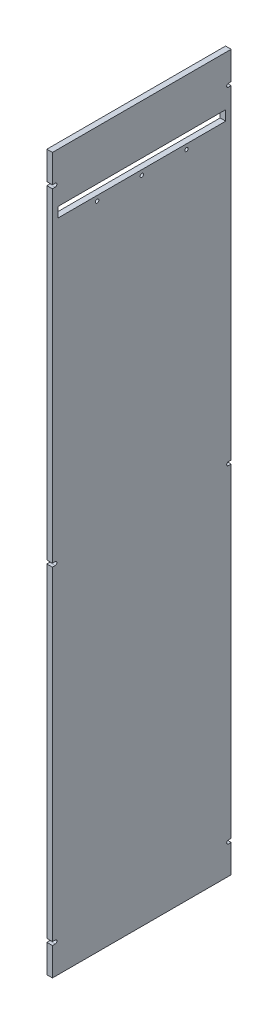
from build123d import *

# Parameters (mm, degrees)
SKETCH1_W             = 4.7625
SKETCH1_H             = 152.4
BOSS_EXTRUDE1_DEPTH   = 609.6
SKETCH2_W             = 143.129
SKETCH2_H             = 8.509
CUT_EXTRUDE1_DEPTH    = 629.379345146
F_4_CLEARANCE_HOLE1_D = 2.9464
CUT_EXTRUDE2_DEPTH    = 629.379345146


with BuildPart() as part:
    # Sketch1 → Boss-Extrude1 (new body)
    with BuildSketch(Plane(origin=(0, 0, 0), x_dir=(1, 0, 0), z_dir=(0, 1, 0))):
        with Locations((2.38125, 76.2)):
            Rectangle(SKETCH1_W, SKETCH1_H)
    extrude(amount=BOSS_EXTRUDE1_DEPTH)

    # Sketch2 → Cut-Extrude1 (cut, through all)
    with BuildSketch(Plane(origin=(4.7625, 0, 0), x_dir=(0, 0, -1), z_dir=(1, 0, 0))):
        with Locations((76.2, 563.0545)):
            Rectangle(SKETCH2_W, SKETCH2_H)
    extrude(amount=-CUT_EXTRUDE1_DEPTH, mode=Mode.SUBTRACT)

    # #4 Clearance Hole1 (through all)
    with Locations(Plane(origin=(4.7625, 0, 0), x_dir=(0, 0, -1), z_dir=(1, 0, 0))):
        with Locations((114.3, 554.5455), (76.2, 554.5455), (38.1, 554.5455)):
            Hole(F_4_CLEARANCE_HOLE1_D / 2)

    # Sketch12 → Cut-Extrude2 (cut, through all)
    with BuildSketch(Plane(origin=(4.7625, 0, 0), x_dir=(0, 0, -1), z_dir=(1, 0, 0))):
        with BuildLine():
            Line((150.01875, 23.9395), (152.4, 23.9395))
            Line((152.4, 23.9395), (152.4, 26.8605))
            Line((152.4, 26.8605), (150.01875, 26.8605))
            ThreePointArc((150.01875, 26.8605), (148.55825, 25.4), (150.01875, 23.9395))
        make_face()
        with BuildLine():
            Line((2.38125, 23.9395), (0, 23.9395))
            Line((0, 23.9395), (0, 26.8605))
            Line((0, 26.8605), (2.38125, 26.8605))
            ThreePointArc((2.38125, 26.8605), (3.84175, 25.4), (2.38125, 23.9395))
        make_face()
        with BuildLine():
            Line((0, 303.3395), (0, 306.2605))
            Line((0, 306.2605), (2.38125, 306.2605))
            ThreePointArc((2.38125, 306.2605), (3.84175, 304.8), (2.38125, 303.3395))
            Line((2.38125, 303.3395), (0, 303.3395))
        make_face()
        with BuildLine():
            Line((152.4, 303.3395), (152.4, 306.2605))
            Line((152.4, 306.2605), (150.01875, 306.2605))
            ThreePointArc((150.01875, 306.2605), (148.55825, 304.8), (150.01875, 303.3395))
            Line((150.01875, 303.3395), (152.4, 303.3395))
        make_face()
        with BuildLine():
            Line((0, 582.7395), (0, 585.6605))
            Line((0, 585.6605), (2.38125, 585.6605))
            ThreePointArc((2.38125, 585.6605), (3.84175, 584.2), (2.38125, 582.7395))
            Line((2.38125, 582.7395), (0, 582.7395))
        make_face()
        with BuildLine():
            Line((152.4, 582.7395), (152.4, 585.6605))
            Line((152.4, 585.6605), (150.01875, 585.6605))
            ThreePointArc((150.01875, 585.6605), (148.55825, 584.2), (150.01875, 582.7395))
            Line((150.01875, 582.7395), (152.4, 582.7395))
        make_face()
    extrude(amount=-CUT_EXTRUDE2_DEPTH, mode=Mode.SUBTRACT)


solid = part.part
